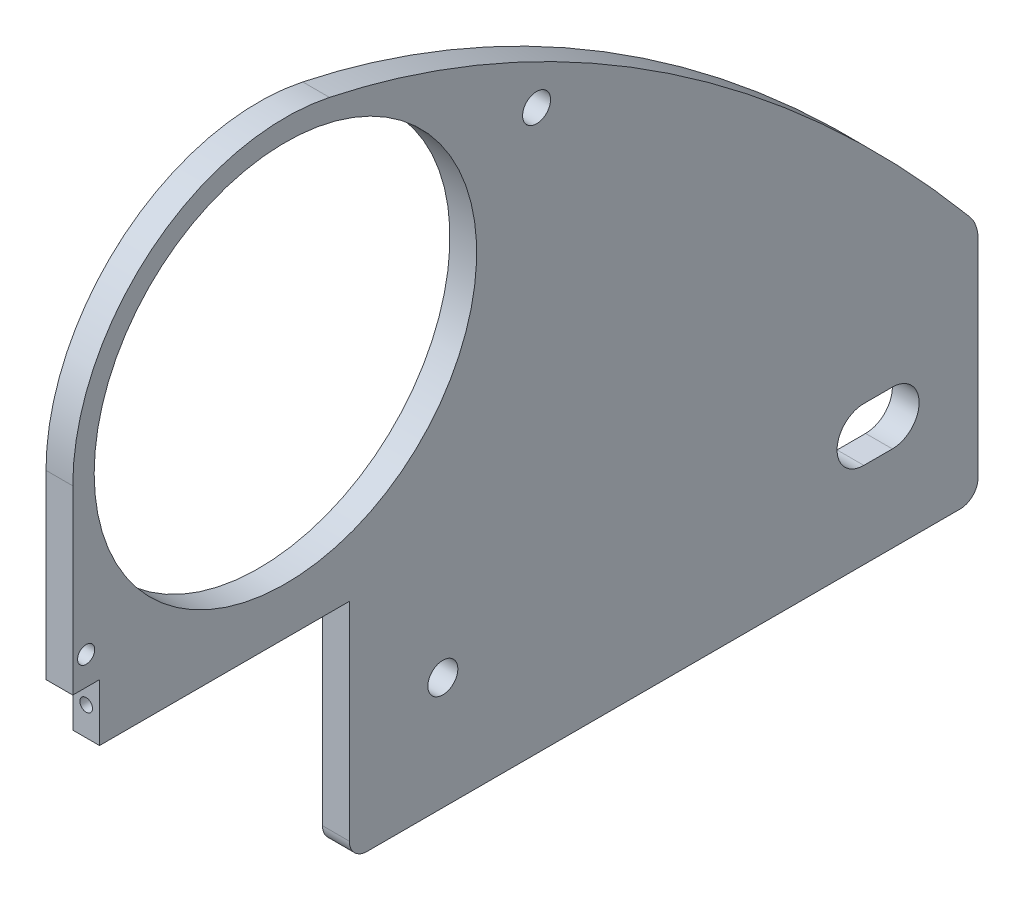
from build123d import *

# Parameters (mm, degrees)
SKETCH1_R           = 1.524
SKETCH1_R_2         = 2.4892
SKETCH1_R_3         = 2.667
SKETCH1_R_4         = 34.04
BOSS_EXTRUDE1_DEPTH = 4.7625
SKETCH2_R           = 1.1303
CUT_EXTRUDE1_DEPTH  = 6.35


with BuildPart() as part:
    # Sketch1 → Boss-Extrude1 (new body)
    with BuildSketch(Plane(origin=(0, 0, 0), x_dir=(0, 0, -1), z_dir=(1, 0, 0))):
        with BuildLine():
            Line((-28.170295117, 0), (77.382795117, 0))
            ThreePointArc((77.382795117, 0), (79.627859148, 0.92993597), (80.557795117, 3.175))
            Line((80.557795117, 3.175), (80.557795117, 40.132))
            ThreePointArc((80.557795117, 40.132), (80.175158576, 42.302961389), (79.073362565, 44.212288398))
            add(Edge.make_bspline(
                [(-34.867281509, 119.579027078), (-0.058341562, 112.208593965), (41.263784204, 89.298575374), (79.073362565, 44.212288398)],
                knots=[0, 0, 0, 0, 1, 1, 1, 1], degree=3))
            ThreePointArc((-34.867281509, 119.579027078), (-66.539067219, 111.95566221), (-80.557795117, 82.55))
            Line((-80.557795117, 82.55), (-80.557795117, 50.292))
            Line((-80.557795117, 50.292), (-75.795295117, 50.292))
            Line((-75.795295117, 50.292), (-75.795295117, 40.132))
            Line((-75.795295117, 40.132), (-31.345295117, 40.132))
            Line((-31.345295117, 40.132), (-31.345295117, 3.175))
            ThreePointArc((-31.345295117, 3.175), (-30.415359148, 0.92993597), (-28.170295117, 0))
        make_face()
        with Locations((-78.176545117, 55.372)):
            Circle(SKETCH1_R, mode=Mode.SUBTRACT)
        with Locations((1.992204883, 99.566852837)):
            Circle(SKETCH1_R_2, mode=Mode.SUBTRACT)
        with Locations((-14.692204883, 20.066)):
            Circle(SKETCH1_R_3, mode=Mode.SUBTRACT)
        with Locations((-42.707795117, 82.55)):
            Circle(SKETCH1_R_4, mode=Mode.SUBTRACT)
        with BuildLine():
            Line((65.317795117, 15.3035), (60.237795117, 15.3035))
            ThreePointArc((60.237795117, 15.3035), (55.475295117, 20.066), (60.237795117, 24.8285))
            Line((60.237795117, 24.8285), (65.317795117, 24.8285))
            ThreePointArc((65.317795117, 24.8285), (70.080295117, 20.066), (65.317795117, 15.3035))
        make_face(mode=Mode.SUBTRACT)
    extrude(amount=BOSS_EXTRUDE1_DEPTH)

    # Sketch2 → Cut-Extrude1 (cut)
    with BuildSketch(Plane.XY.offset(75.795295117)):
        with Locations((2.38125, 45.212)):
            Circle(SKETCH2_R)
    extrude(amount=-CUT_EXTRUDE1_DEPTH, mode=Mode.SUBTRACT)


solid = part.part
